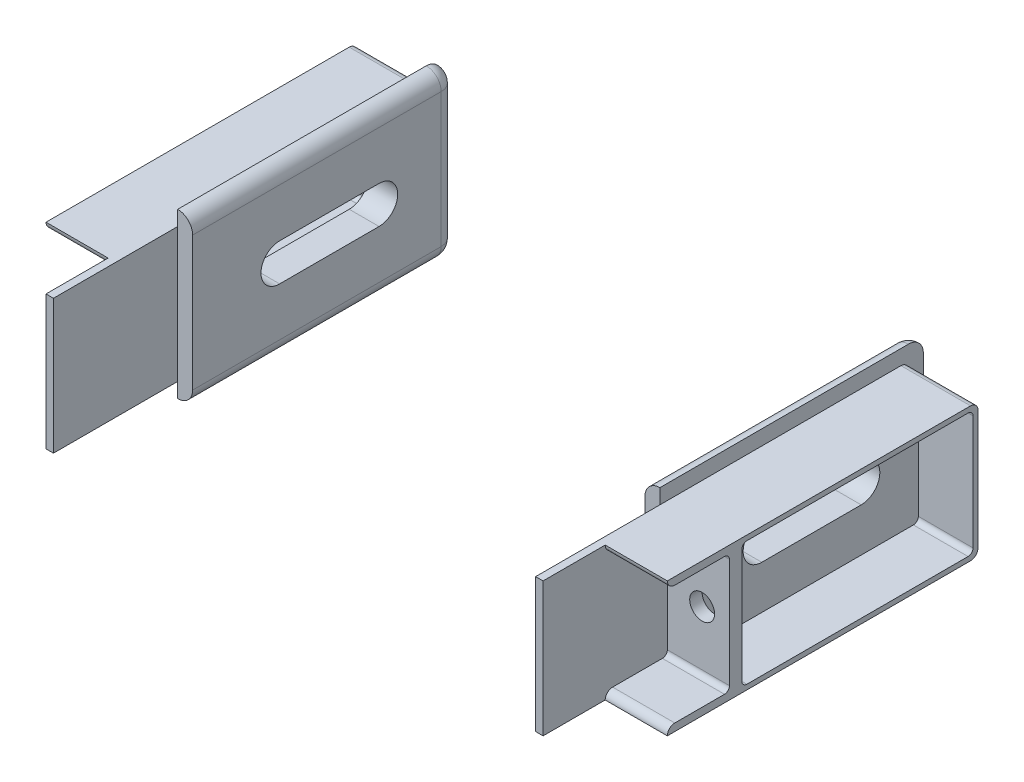
from build123d import *

# Parameters (mm, degrees)
DODANIE_WYCI_GNI_CIE1_START = 91
SZKIC12_W                   = 100
SZKIC12_H                   = 54
DODANIE_WYCI_GNI_CIE1_DEPTH = 34
DODANIE_WYCI_GNI_CIE4_START = 91
DODANIE_WYCI_GNI_CIE4_DEPTH = 6
SZKIC15_W                   = 93
SZKIC15_H                   = 50
WYTNIJ_WYCI_GNI_CIE1_DEPTH  = 22
WYTNIJ_WYCI_GNI_CIE2_REACH  = 169.183
SZKIC16_R                   = 5
SZKIC16_3_W                 = 3
SZKIC16_3_H                 = 54
DODANIE_WYCI_GNI_CIE2_DEPTH = 50
SZKIC18_W                   = 25
SZKIC18_H                   = 3
DODANIE_WYCI_GNI_CIE3_DEPTH = 25
ZAOKR_GLENIE9_R             = 3
ZAOKR_GLENIE8_R             = 2
ZAOKR_GLENIE10_R            = 6


# Some blends are built 0.0001 mm under size
with BuildPart() as part:
    # Szkic12 → Dodanie-wyciągnięcie1 (new body)
    with BuildSketch(Plane(origin=(0, 0, 0), x_dir=(0, 0, -1), z_dir=(1, 0, 0)).offset(DODANIE_WYCI_GNI_CIE1_START)):
        with Locations((517, 0)):
            Rectangle(SZKIC12_W, SZKIC12_H)
        with BuildLine():
            Line((502, 7.5), (542, 7.5))
            ThreePointArc((542, 7.5), (549.5, 0), (542, -7.5))
            Line((542, -7.5), (502, -7.5))
            ThreePointArc((502, -7.5), (494.5, 0), (502, 7.5))
        make_face(mode=Mode.SUBTRACT)
    extrude(amount=DODANIE_WYCI_GNI_CIE1_DEPTH)

    # Szkic12<4> → Dodanie-wyciągnięcie4 (add)
    with BuildSketch(Plane(origin=(0, 0, 0), x_dir=(0, 0, -1), z_dir=(1, 0, 0)).offset(DODANIE_WYCI_GNI_CIE4_START)):
        Polygon((467, -27), (467, -33), (573, -33), (573, 33), (467, 33), (467, 27), (567, 27), (567, -27), align=None)
    extrude(amount=DODANIE_WYCI_GNI_CIE4_DEPTH)

    # Szkic15 → Wytnij-wyciągnięcie1 (cut)
    with BuildSketch(Plane(origin=(125, 0, 0), x_dir=(0, 0, -1), z_dir=(1, 0, 0))):
        with Locations((518.5, 0)):
            Rectangle(SZKIC15_W, SZKIC15_H)
    extrude(amount=-WYTNIJ_WYCI_GNI_CIE1_DEPTH, mode=Mode.SUBTRACT)

    # Szkic16 → Wytnij-wyciągnięcie2 (cut, up to next)
    with BuildSketch(Plane.XY.offset(-467), mode=Mode.PRIVATE) as wytnij_wyci_gni_cie2_sk1:
        with Locations((114, 0)):
            Circle(SZKIC16_R)
    wytnij_wyci_gni_cie2_tool1 = extrude(wytnij_wyci_gni_cie2_sk1.sketch, amount=-WYTNIJ_WYCI_GNI_CIE2_REACH, mode=Mode.PRIVATE) & part.part
    add(wytnij_wyci_gni_cie2_tool1.solids().sort_by_distance((114, 0, -467))[0], mode=Mode.SUBTRACT)

    # Szkic16<3> → Dodanie-wyciągnięcie2 (add)
    with BuildSketch(Plane.XY.offset(-467)):
        with Locations((98.5, 0)):
            Rectangle(SZKIC16_3_W, SZKIC16_3_H)
    extrude(amount=DODANIE_WYCI_GNI_CIE2_DEPTH)

    # Szkic18 → Dodanie-wyciągnięcie3 (add)
    with BuildSketch(Plane(origin=(100, 0, 0), x_dir=(0, 0, -1), z_dir=(1, 0, 0))):
        with Locations((454.5, -25.5)):
            Rectangle(SZKIC18_W, SZKIC18_H)
        with Locations((454.5, 25.5)):
            Rectangle(SZKIC18_W, SZKIC18_H)
    extrude(amount=DODANIE_WYCI_GNI_CIE3_DEPTH)

    # Zaokrąglenie9
    zaokr_glenie9_edges = [part.edges().sort_by_distance(p)[0] for p in [
        (111, -27, -567),
        (111, 27, -567),
        (112.5, -24, -442),
        (112.5, 24, -442),
    ]]
    fillet(zaokr_glenie9_edges, radius=ZAOKR_GLENIE9_R - 0.0001)  # a hair under: the kernel refuses the full size

    # Zaokrąglenie8
    zaokr_glenie8_edges = [part.edges().sort_by_distance(p)[0] for p in [
        (112.5, -24, -467),
        (114, -25, -472),
        (114, 25, -472),
        (114, 25, -565),
        (114, -25, -565),
        (112.5, 24, -467),
    ]]
    fillet(zaokr_glenie8_edges, radius=ZAOKR_GLENIE8_R)

    # Zaokrąglenie10
    # the kernel refuses this fillet: 6 mm, written as the material it takes off along each edge
    with BuildSketch(Plane(origin=(97, 27, -567), x_dir=(0, 1, 0), z_dir=(-1, 0, 0))) as zaokr_glenie10_piece_1_section:
        Polygon((0, 0), (ZAOKR_GLENIE10_R * 1.02, 0), (ZAOKR_GLENIE10_R * 1.02, ZAOKR_GLENIE10_R * 1.02), (0, ZAOKR_GLENIE10_R * 1.02), align=None)
    zaokr_glenie10_piece_1 = extrude(amount=ZAOKR_GLENIE10_R * 1.02, mode=Mode.PRIVATE)
    zaokr_glenie10_piece_1 = zaokr_glenie10_piece_1 - Plane(origin=(97, 27, -567), x_dir=(0, -0.7071067811865475, 0.7071067811865477), z_dir=(-1, 0, 0)) * Sphere(ZAOKR_GLENIE10_R, mode=Mode.PRIVATE)
    add(zaokr_glenie10_piece_1, mode=Mode.SUBTRACT)
    with BuildSketch(Plane(origin=(97, -27, -567), x_dir=(0, 0, -1), z_dir=(-1, 0, 0))) as zaokr_glenie10_piece_2_section:
        Polygon((0, 0), (ZAOKR_GLENIE10_R * 1.02, 0), (ZAOKR_GLENIE10_R * 1.02, ZAOKR_GLENIE10_R * 1.02), (0, ZAOKR_GLENIE10_R * 1.02), align=None)
    zaokr_glenie10_piece_2 = extrude(amount=ZAOKR_GLENIE10_R * 1.02, mode=Mode.PRIVATE)
    zaokr_glenie10_piece_2 = zaokr_glenie10_piece_2 - Plane(origin=(97, -27, -567), x_dir=(0, 0.7071067811865475, 0.7071067811865475), z_dir=(-1, 0, 0)) * Sphere(ZAOKR_GLENIE10_R, mode=Mode.PRIVATE)
    add(zaokr_glenie10_piece_2, mode=Mode.SUBTRACT)
    with BuildSketch(Plane(origin=(91, -33, -452), x_dir=(1, 0, 0), z_dir=(0, 0, -1)), Plane(origin=(91, 33, -567), x_dir=(1, 0, 0), z_dir=(0, 0, 1))) as zaokr_glenie10_piece_3:
        with BuildLine():
            CenterArc((ZAOKR_GLENIE10_R, -ZAOKR_GLENIE10_R), ZAOKR_GLENIE10_R, 90, 90)
            Line((0, -ZAOKR_GLENIE10_R), (0, 0))
            Line((0, 0), (ZAOKR_GLENIE10_R, 0))
        make_face()
    extrude(amount=115, mode=Mode.SUBTRACT)
    with BuildSketch(Plane(origin=(91, -27, -573), x_dir=(1, 0, 0), z_dir=(0, 1, 0))) as zaokr_glenie10_piece_4:
        with BuildLine():
            CenterArc((ZAOKR_GLENIE10_R, -ZAOKR_GLENIE10_R), ZAOKR_GLENIE10_R, 90, 90)
            Line((0, -ZAOKR_GLENIE10_R), (0, 0))
            Line((0, 0), (ZAOKR_GLENIE10_R, 0))
        make_face()
    extrude(amount=54, mode=Mode.SUBTRACT)


with BuildPart() as body_2:
    # Lustro5: mirrored copy
    add(part.part.mirror(Plane(origin=(0, 0, 0), x_dir=(0, 0, 1), z_dir=(1, 0, 0))))


solid = Compound([part.part, body_2.part])
